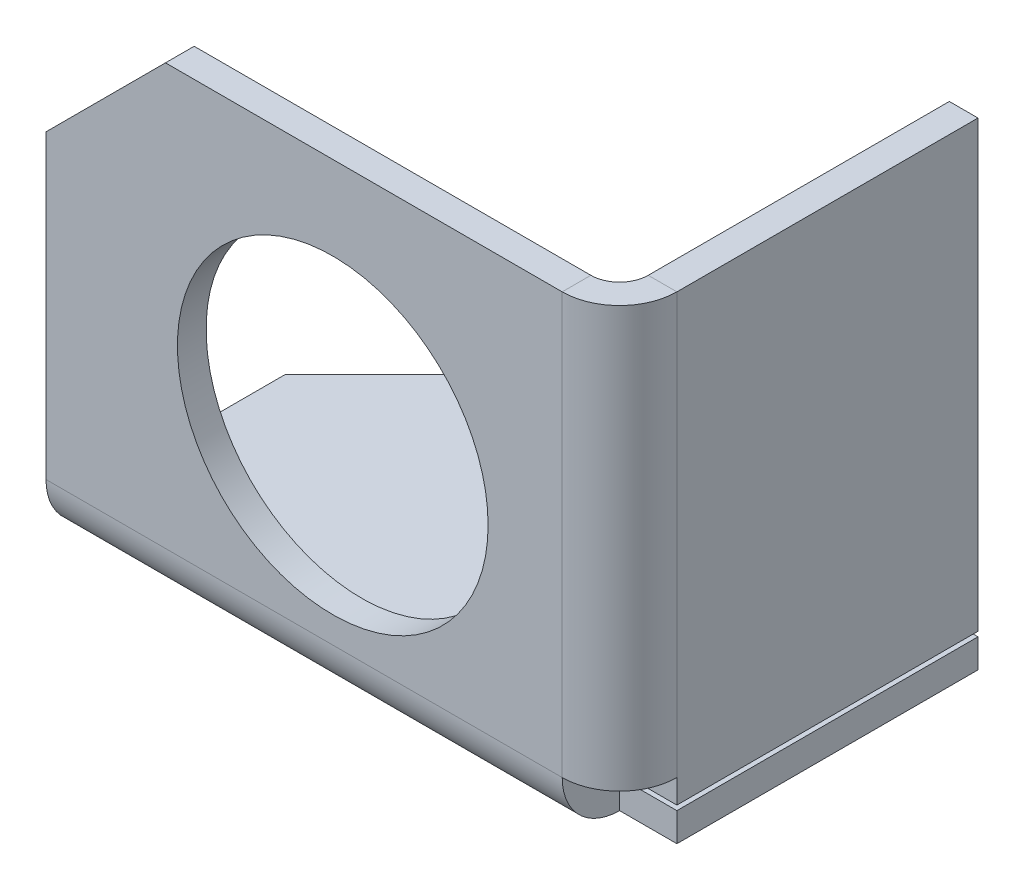
from build123d import *

# Parameters (mm, degrees)
SKETCH_1_W                       = 120
SKETCH_1_H                       = 88
SKETCH_1_R                       = 32.5
SM_BASE_FLANGE_1_DEPTH           = 6
SM_EDGE_FLANGE_5_STRIP_W         = 36
SM_EDGE_FLANGE_5_STRIP_H         = 6
SM_EDGE_FLANGE_5_STRIP_CUT_DEPTH = 88
SM_EDGE_FLANGE_5_DEPTH           = 88
SM_EDGE_FLANGE_7_DEPTH           = 108
OTHER_START                      = -12
OTHER_1_OUTLINE_W                = 12
OTHER_1_OUTLINE_H                = 63
OTHER_1_DEPTH                    = 6
OTHER_START_2                    = -5
OTHER_1_2_OUTLINE_W              = 6
OTHER_1_2_OUTLINE_H              = 63
OTHER_1_2_DEPTH                  = 5
CHAMFER_1_SIZE                   = 25
MOVE_START                       = -12
MOVE_BODY_1_DEPTH                = 100
MOVE_START_2                     = -5
MOVE_BODY_1_2_OUTLINE_W          = 108
MOVE_BODY_1_2_OUTLINE_H          = 12
MOVE_BODY_1_2_OUTLINE_W_2        = 6
MOVE_BODY_1_2_OUTLINE_H_2        = 63
MOVE_BODY_1_2_DEPTH              = 93
MOVE_BODY_1_3_DEPTH              = 6
MOVE_BODY_1_4_DEPTH              = 88
MOVE_START_3                     = -6
MOVE_BODY_1_5_OUTLINE_W          = 108
MOVE_BODY_1_5_OUTLINE_H          = 12
MOVE_BODY_1_5_DEPTH              = 1
MOVE_BODY_1_6_OUTLINE_R          = 32.5
MOVE_BODY_1_6_DEPTH              = 12
MOVE_BODY_1_7_DEPTH              = 108


with BuildPart() as part:
    # Базовая кромка1: sheet metal written as solids
    # Sketch 1 → Базовая кромка1 (new body)
    with BuildSketch(Plane.XY):
        with Locations((60, 44)):
            Rectangle(SKETCH_1_W, SKETCH_1_H)
        with Locations((60, 38)):
            Circle(SKETCH_1_R, mode=Mode.SUBTRACT)
    extrude(amount=-SM_BASE_FLANGE_1_DEPTH)

    # Ребро-кромка5: sheet metal written as solids
    # Ребро-кромка5 strip (on a plane across the edge) → Ребро-кромка5 strip cut (cut)
    with BuildSketch(Plane(origin=(120, 0, 0), x_dir=(-1, 0, 0), z_dir=(0, 1, 0))):
        with Locations((-6, -3)):
            Rectangle(SM_EDGE_FLANGE_5_STRIP_W, SM_EDGE_FLANGE_5_STRIP_H)
    extrude(amount=SM_EDGE_FLANGE_5_STRIP_CUT_DEPTH, mode=Mode.SUBTRACT)

    # Ребро-кромка5 section (on a plane across the edge) → Ребро-кромка5 (add)
    with BuildSketch(Plane(origin=(120, 0, 0), x_dir=(-1, 0, 0), z_dir=(0, 1, 0))):
        with BuildLine():
            Line((0, 6), (0, 69))
            Line((0, 69), (6, 69))
            Line((6, 69), (6, 6))
            ThreePointArc((6, 6), (7.757359313, 1.757359313), (12, 0))
            Line((12, 0), (12, -6))
            ThreePointArc((12, -6), (3.514718626, -2.485281374), (0, 6))
        make_face()
    extrude(amount=SM_EDGE_FLANGE_5_DEPTH)

    # Ребро-кромка7: sheet metal written as solids
    # Ребро-кромка7 section (on a plane across the edge) → Ребро-кромка7 (add)
    with BuildSketch(Plane(origin=(0, -6, 0), x_dir=(0, 1, 0), z_dir=(1, 0, 0))):
        with BuildLine():
            Line((-6, 6), (-6, 69))
            Line((-6, 69), (0, 69))
            Line((0, 69), (0, 6))
            ThreePointArc((0, 6), (1.757359313, 1.757359313), (6, 0))
            Line((6, 0), (6, -6))
            ThreePointArc((6, -6), (-2.485281374, -2.485281374), (-6, 6))
        make_face()
    extrude(amount=SM_EDGE_FLANGE_7_DEPTH)

    # Other 1: read off the stored shape, not the designer's step
    # Other 1 outline → Other 1 (add)
    with BuildSketch(Plane(origin=(0, 0, 0), x_dir=(1, 0, 0), z_dir=(0, 1, 0)).offset(OTHER_START)):
        with Locations((114, -37.5)):
            Rectangle(OTHER_1_OUTLINE_W, OTHER_1_OUTLINE_H)
    extrude(amount=OTHER_1_DEPTH)

    # Other 1 2 outline → Other 1 2 (add)
    with BuildSketch(Plane(origin=(0, 0, 0), x_dir=(1, 0, 0), z_dir=(0, 1, 0)).offset(OTHER_START_2)):
        with Locations((117, -37.5)):
            Rectangle(OTHER_1_2_OUTLINE_W, OTHER_1_2_OUTLINE_H)
    extrude(amount=OTHER_1_2_DEPTH)

    # Фаска1
    chamfer_1_edges = [part.edges().sort_by_distance(p)[0] for p in [
        (0, -9, 69),
        (0, 88, -3),
    ]]
    chamfer(chamfer_1_edges, length=CHAMFER_1_SIZE)

    # Move Body 1: read off the stored shape, not the designer's step
    # Move Body 1 outline → Move Body 1 (cut)
    with BuildSketch(Plane(origin=(0, 0, 0), x_dir=(1, 0, 0), z_dir=(0, 1, 0)).offset(MOVE_START)):
        with BuildLine():
            Line((0, -6), (0, -44))
            Line((0, -44), (25, -69))
            Line((25, -69), (120, -69))
            Line((120, -69), (120, -6))
            ThreePointArc((120, -6), (119.591109915, -2.894171459), (118.392304845, 0))
            ThreePointArc((118.392304845, 0), (116.40755123, -2.562305899), (113.809475019, -4.5))
            ThreePointArc((113.809475019, -4.5), (113.952178178, -5.243974245), (114, -6))
            Line((114, -6), (0, -6))
        make_face()
        with BuildLine():
            Line((108, 6), (108, 0))
            ThreePointArc((108, 0), (111.674234614, 1.25658351), (113.809475019, 4.5))
            ThreePointArc((113.809475019, 4.5), (111, 5.618950038), (108, 6))
        make_face()
    extrude(amount=MOVE_BODY_1_DEPTH, mode=Mode.SUBTRACT)

    # Move Body 1 2 outline → Move Body 1 2 (add)
    with BuildSketch(Plane(origin=(0, 0, 0), x_dir=(1, 0, 0), z_dir=(0, 1, 0)).offset(MOVE_START_2)):
        with Locations((54, 0)):
            Rectangle(MOVE_BODY_1_2_OUTLINE_W, MOVE_BODY_1_2_OUTLINE_H)
        with Locations((117, 37.5)):
            Rectangle(MOVE_BODY_1_2_OUTLINE_W_2, MOVE_BODY_1_2_OUTLINE_H_2)
    extrude(amount=MOVE_BODY_1_2_DEPTH)

    # Move Body 1 3 outline → Move Body 1 3 (add)
    with BuildSketch(Plane(origin=(0, 0, 0), x_dir=(1, 0, 0), z_dir=(0, 1, 0)).offset(MOVE_START)):
        Polygon((0, -6), (108, -6), (108, 6), (120, 6), (120, 69), (25, 69), (0, 44), align=None)
    extrude(amount=MOVE_BODY_1_3_DEPTH)

    # Move Body 1 4 outline → Move Body 1 4 (add)
    with BuildSketch(Plane(origin=(0, 0, 0), x_dir=(1, 0, 0), z_dir=(0, 1, 0))):
        with BuildLine():
            Line((108, 0), (108, -6))
            ThreePointArc((108, -6), (111, -5.618950038), (113.809475019, -4.5))
            ThreePointArc((113.809475019, -4.5), (111.674234614, -1.25658351), (108, 0))
        make_face()
        with BuildLine():
            ThreePointArc((113.809475019, 4.5), (116.40755123, 2.562305899), (118.392304845, 0))
            ThreePointArc((118.392304845, 0), (119.591109915, 2.894171459), (120, 6))
            Line((120, 6), (114, 6))
            ThreePointArc((114, 6), (113.952178178, 5.243974245), (113.809475019, 4.5))
        make_face()
    extrude(amount=MOVE_BODY_1_4_DEPTH)

    # Move Body 1 5 outline → Move Body 1 5 (add)
    with BuildSketch(Plane(origin=(0, 0, 0), x_dir=(1, 0, 0), z_dir=(0, 1, 0)).offset(MOVE_START_3)):
        with Locations((54, 0)):
            Rectangle(MOVE_BODY_1_5_OUTLINE_W, MOVE_BODY_1_5_OUTLINE_H)
    extrude(amount=MOVE_BODY_1_5_DEPTH)

    # Move Body 1 6 outline → Move Body 1 6 (cut)
    with BuildSketch(Plane.XY.offset(MOVE_START_3)):
        with Locations((60, 38)):
            Circle(MOVE_BODY_1_6_OUTLINE_R)
        Polygon((0, 88), (0, 63), (25, 88), align=None)
    extrude(amount=MOVE_BODY_1_6_DEPTH, mode=Mode.SUBTRACT)

    # Move Body 1 7 outline → Move Body 1 7 (cut)
    with BuildSketch(Plane.YZ):
        with BuildLine():
            Line((88, -6), (88, 0))
            Line((88, 0), (0, 0))
            ThreePointArc((0, 0), (-4.242640687, -1.757359313), (-6, -6))
            Line((-6, -6), (88, -6))
        make_face()
        with BuildLine():
            ThreePointArc((-12, -6), (-8.485281374, 2.485281374), (0, 6))
            Line((0, 6), (-12, 6))
            Line((-12, 6), (-12, -6))
        make_face()
    extrude(amount=MOVE_BODY_1_7_DEPTH, mode=Mode.SUBTRACT)


solid = part.part
